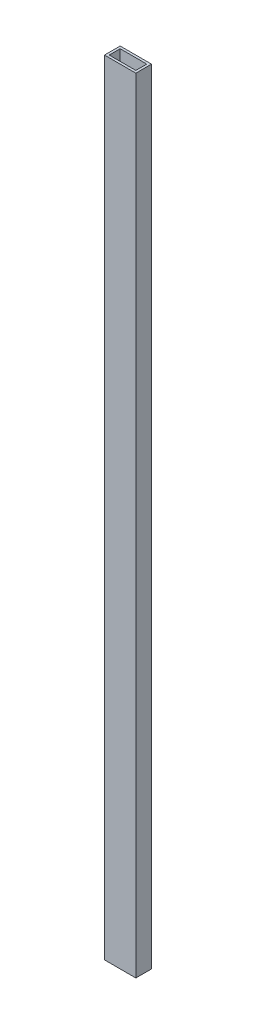
from build123d import *

# Parameters (mm, degrees)
SKETCH_1_W      = 40
SKETCH_1_H      = 20
SKETCH_1_W_2    = 34
SKETCH_1_H_2    = 14
EXTRUDE_1_DEPTH = 1000


with BuildPart() as part:
    # Эскиз1 → Вытянуть-Тонкостенный1 (new body)
    with BuildSketch(Plane(origin=(0, 0, 0), x_dir=(1, 0, 0), z_dir=(0, 1, 0))):
        Rectangle(SKETCH_1_W, SKETCH_1_H)
        Rectangle(SKETCH_1_W_2, SKETCH_1_H_2, mode=Mode.SUBTRACT)
    extrude(amount=EXTRUDE_1_DEPTH)


solid = part.part
